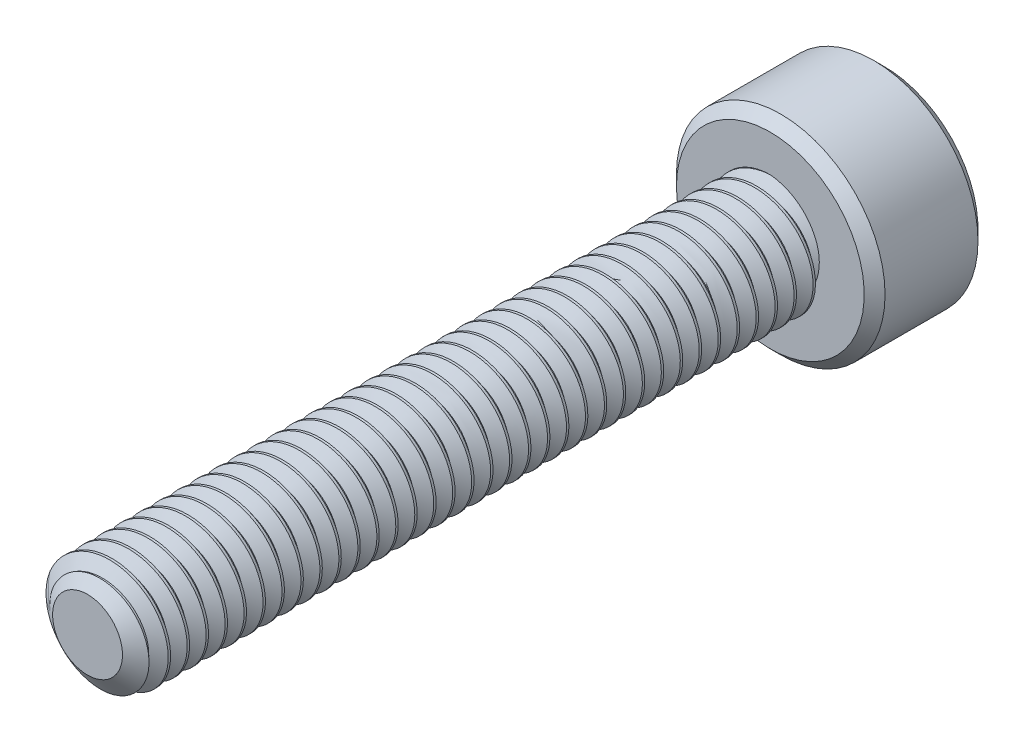
from build123d import *

# Parameters (mm, degrees)
SKETCH1_R          = 1.5
EXTRUDE1_DEPTH     = 18
CUT_SWEEP1_PITCH   = 0.5
SKETCH6_R          = 2.75
EXTRUDE2_DEPTH     = 3
CUT_EXTRUDE1_DEPTH = 1.875
CHAMFER1_SIZE      = 0.275


with BuildPart() as part:
    # Sketch1 → Extrude1 (new body)
    with BuildSketch(Plane.XY):
        Circle(SKETCH1_R)
    extrude(amount=-EXTRUDE1_DEPTH)

    # Cut-Sweep1: arcs per turn and ends read off the stored shape
    # Cut-Sweep1: the profile of Sketch3 profile screwed along a right-hand helix through 39 turns, 6 arcs to a turn; built about Z, then put on its axis
    cut_sweep1_z = Axis((0, 0, 0), (0, 0, 1))
    cut_sweep1_corners = [(1.5003, 0, -0.937673205), (1.175240474, 0, -0.75), (1.175240474, 0, -0.6875), (1.5003, 0, -0.499826795)]
    with BuildLine(mode=Mode.PRIVATE) as cut_sweep1_profile:
        Line(cut_sweep1_corners[0], cut_sweep1_corners[1])
        Line(cut_sweep1_corners[1], cut_sweep1_corners[2])
        Line(cut_sweep1_corners[2], cut_sweep1_corners[3])
        Line(cut_sweep1_corners[3], cut_sweep1_corners[0])
    cut_sweep1_cap = Face(cut_sweep1_profile.wire())
    cut_sweep1_turn_angles = [0, 30, 60, 90, 120, 150, 180, 210, 240, 270, 300, 330, 360]
    cut_sweep1_turn_weights = [1, 0.8660254037844387, 1, 0.8660254037844387, 1, 0.8660254037844387, 1, 0.8660254037844387, 1, 0.8660254037844387, 1, 0.8660254037844387, 1]
    cut_sweep1_turn_rails = [Edge.make_bspline([Vector(p[0], p[1], 0).rotate(cut_sweep1_z, cut_sweep1_turn_angles[k]) / cut_sweep1_turn_weights[k] + Vector(0, 0, p[2] + CUT_SWEEP1_PITCH * cut_sweep1_turn_angles[k] / 360) for k in range(13)], [0, 0, 0, 1, 1, 2, 2, 3, 3, 4, 4, 5, 5, 6, 6, 6], 2, cut_sweep1_turn_weights) for p in cut_sweep1_corners]
    cut_sweep1_turn_sides = [Face.make_surface_from_curves(cut_sweep1_turn_rails[p[0]], cut_sweep1_turn_rails[p[1]]) for p in [(0, 1), (1, 2), (2, 3), (3, 0)]]
    cut_sweep1 = Plane(origin=(0, 0, 0), x_dir=(0, 1, 0), z_dir=(0, 0, -1)) * Solid(Shell([*[p.moved(Location((0, 0, CUT_SWEEP1_PITCH * i))) for i in range(39) for p in cut_sweep1_turn_sides], cut_sweep1_cap, cut_sweep1_cap.rotate(cut_sweep1_z, 14040).moved(Location((0, 0, CUT_SWEEP1_PITCH * 14040 / 360)))]))
    add(cut_sweep1, mode=Mode.SUBTRACT)

    # Sketch4 → Cut-Revolve1 (revolve, cut)
    with BuildSketch(Plane(origin=(0, 0, 0), x_dir=(0, 0, -1), z_dir=(1, 0, 0)), mode=Mode.PRIVATE) as cut_revolve1_sk:
        Polygon((0.405251783, 1.5), (0, 0.921240474), (0, 1.5), align=None)
    revolve(cut_revolve1_sk.sketch.rotate(Axis((0, 0, 0), (0, 0, -1)), 263.352109169), axis=Axis((0, 0, 0), (0, 0, -1)), mode=Mode.SUBTRACT)

    # Sketch6 → Extrude2 (add)
    with BuildSketch(Plane(origin=(0, 0, -18), x_dir=(-1, 0, 0), z_dir=(0, 0, -1))):
        Circle(SKETCH6_R)
    extrude(amount=EXTRUDE2_DEPTH)

    # Sketch7 → Cut-Extrude1 (cut)
    with BuildSketch(Plane(origin=(0, 0, -21), x_dir=(-1, 0, 0), z_dir=(0, 0, -1))):
        Polygon((0, 1.443375673), (-1.25, 0.721687836), (-1.25, -0.721687836), (0, -1.443375673), (1.25, -0.721687836), (1.25, 0.721687836), align=None)
    extrude(amount=-CUT_EXTRUDE1_DEPTH, mode=Mode.SUBTRACT)

    # Cut-Extrude2 cone 1 section (through the dimple's axis) → Cut-Extrude2 (revolve, cut)
    with BuildSketch(Plane(origin=(0, 0, -21), x_dir=(0, 1, 0), z_dir=(1, 0, 0))):
        Polygon((0, 0), (1.443375673, 0), (0, 1.443375673), align=None)
    revolve(axis=Axis((0, 0, -21), (0, 0, 1)), mode=Mode.SUBTRACT)

    # Chamfer1
    chamfer1_edges = [part.edges().sort_by_distance(p)[0] for p in [
        (2.75, 0, -18),
        (2.75, 0, -21),
    ]]
    chamfer(chamfer1_edges, length=CHAMFER1_SIZE)


solid = part.part
